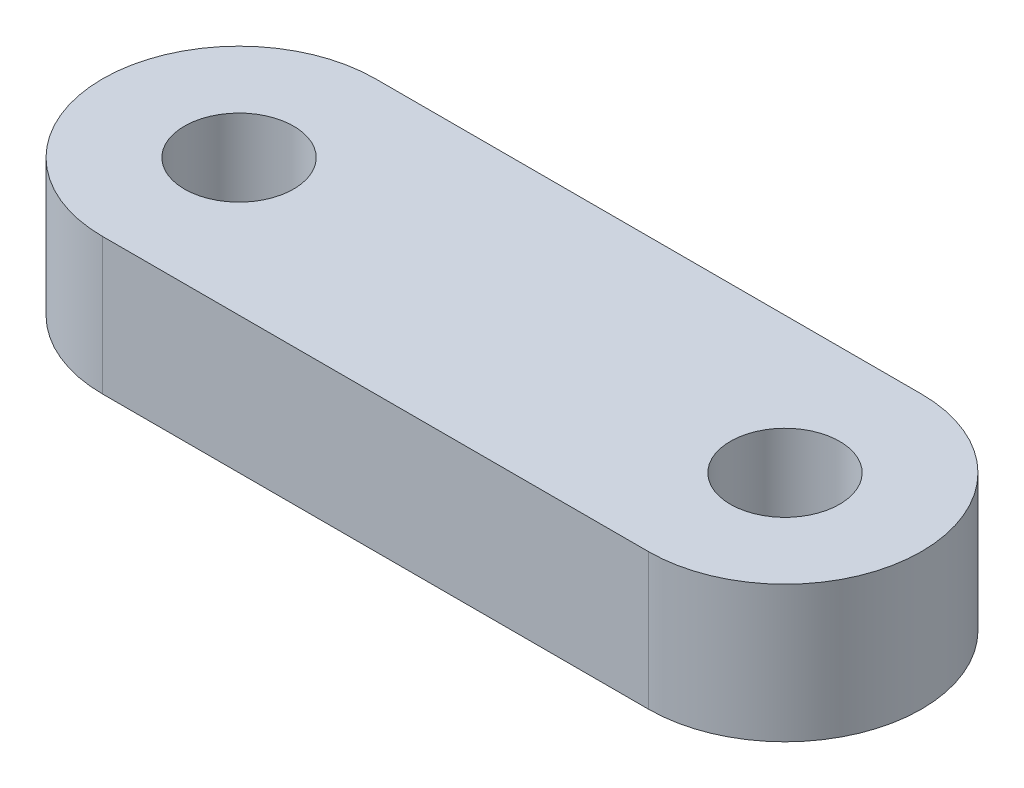
from build123d import *

# Parameters (mm, degrees)
SKETCH_1_R      = 2
EXTRUDE_1_DEPTH = 5


with BuildPart() as part:
    # 草圖1 → 填料-伸長1 (new body)
    with BuildSketch(Plane(origin=(0, 0, 0), x_dir=(1, 0, 0), z_dir=(0, 1, 0))):
        with BuildLine():
            Line((-10, 5), (10, 5))
            ThreePointArc((10, 5), (15, 0), (10, -5))
            Line((10, -5), (-10, -5))
            ThreePointArc((-10, -5), (-15, 0), (-10, 5))
        make_face()
        with Locations((-10, 0)):
            Circle(SKETCH_1_R, mode=Mode.SUBTRACT)
        with Locations((10, 0)):
            Circle(SKETCH_1_R, mode=Mode.SUBTRACT)
    extrude(amount=EXTRUDE_1_DEPTH)


solid = part.part
